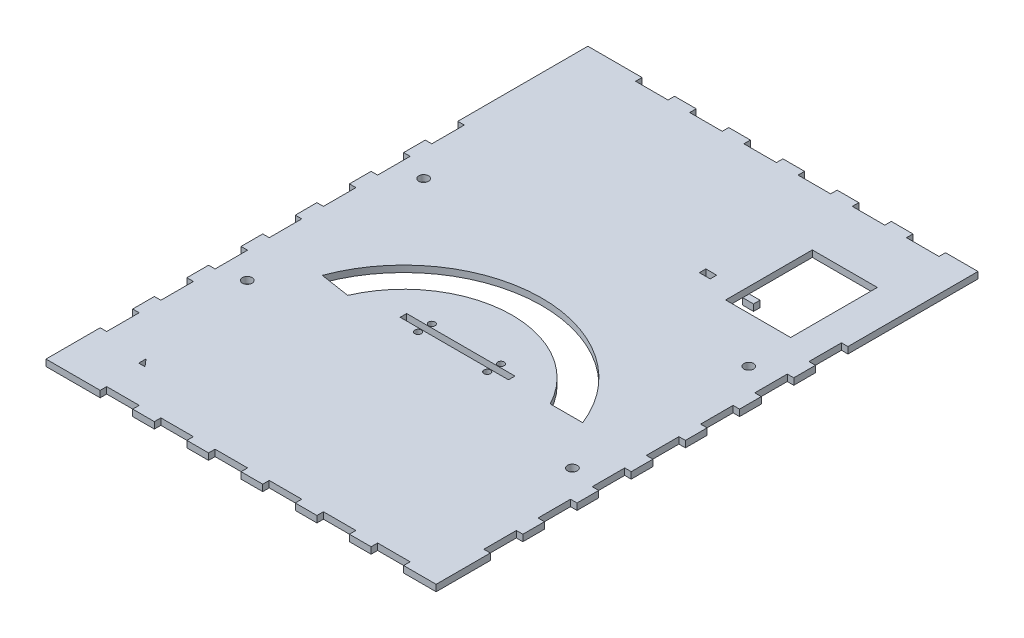
from build123d import *

# Parameters (mm, degrees)
BOSS_EXTRUDE1_DEPTH = 3
CUT_EXTRUDE1_DEPTH  = 10
SKETCH3_R           = 1.5
SKETCH3_R_2         = 2.25
SKETCH3_W           = 50
SKETCH3_H           = 3
SKETCH3_W_2         = 5
SKETCH3_W_3         = 30
SKETCH3_H_2         = 40
CUT_EXTRUDE8_DEPTH  = 9


with BuildPart() as part:
    # Sketch1 → Boss-Extrude1 (new body)
    with BuildSketch(Plane(origin=(0, 0, 0), x_dir=(1, 0, 0), z_dir=(0, 1, 0))):
        Polygon((-87.356947197, -190.101323735), (-90.356947197, -190.101323735), (-90.356947197, -215.101323735), (-65.356947197, -215.101323735), (-65.356947197, -212.101323735), (-50.356947197, -212.101323735), (-50.356947197, -215.101323735), (-40.356947197, -215.101323735), (-40.356947197, -212.101323735), (-25.356947197, -212.101323735), (-25.356947197, -215.101323735), (-15.356947197, -215.101323735), (-15.356947197, -212.101323735), (-0.356947197, -212.101323735), (-0.356947197, -215.101323735), (9.643052803, -215.101323735), (9.643052803, -212.101323735), (24.643052803, -212.101323735), (24.643052803, -215.101323735), (34.643052803, -215.101323735), (34.643052803, -212.101323735), (49.643052803, -212.101323735), (49.643052803, -215.101323735), (59.643052803, -215.101323735), (59.643052803, -212.101323735), (74.643052803, -212.101323735), (74.643052803, -215.101323735), (89.643052803, -215.101323735), (89.643052803, -190.101323735), (86.643052803, -190.101323735), (86.643052803, -175.101323735), (89.643052803, -175.101323735), (89.643052803, -165.101323735), (86.643052803, -165.101323735), (86.643052803, -150.101323735), (89.643052803, -150.101323735), (89.643052803, -140.101323735), (86.643052803, -140.101323735), (86.643052803, -125.101323735), (89.643052803, -125.101323735), (89.643052803, -115.101323735), (86.643052803, -115.101323735), (86.643052803, -100.101323735), (89.643052803, -100.101323735), (89.643052803, -90.101323735), (86.643052803, -90.101323735), (86.643052803, -75.101323735), (89.643052803, -75.101323735), (89.643052803, -65.101323735), (86.643052803, -65.101323735), (86.643052803, -50.101323735), (89.643052803, -50.101323735), (89.643052803, -40.101323735), (86.643052803, -40.101323735), (86.643052803, -25.101323735), (89.643052803, -25.101323735), (89.643052803, 34.898676265), (74.643052803, 34.898676265), (74.643052803, 31.898676265), (59.643052803, 31.898676265), (59.643052803, 34.898676265), (49.643052803, 34.898676265), (49.643052803, 31.898676265), (34.643052803, 31.898676265), (34.643052803, 34.898676265), (24.643052803, 34.898676265), (24.643052803, 31.898676265), (9.643052803, 31.898676265), (9.643052803, 34.898676265), (-0.356947197, 34.898676265), (-0.356947197, 31.898676265), (-15.356947197, 31.898676265), (-15.356947197, 34.898676265), (-25.356947197, 34.898676265), (-25.356947197, 31.898676265), (-40.356947197, 31.898676265), (-40.356947197, 34.898676265), (-50.356947197, 34.898676265), (-50.356947197, 31.898676265), (-65.356947197, 31.898676265), (-65.356947197, 34.898676265), (-90.356947197, 34.898676265), (-90.356947197, -25.101323735), (-87.356947197, -25.101323735), (-87.356947197, -40.101323735), (-90.356947197, -40.101323735), (-90.356947197, -50.101323735), (-87.356947197, -50.101323735), (-87.356947197, -65.101323735), (-90.356947197, -65.101323735), (-90.356947197, -75.101323735), (-87.356947197, -75.101323735), (-87.356947197, -90.101323735), (-90.356947197, -90.101323735), (-90.356947197, -100.101323735), (-87.356947197, -100.101323735), (-87.356947197, -115.101323735), (-90.356947197, -115.101323735), (-90.356947197, -125.101323735), (-87.356947197, -125.101323735), (-87.356947197, -140.101323735), (-90.356947197, -140.101323735), (-90.356947197, -150.101323735), (-87.356947197, -150.101323735), (-87.356947197, -165.101323735), (-90.356947197, -165.101323735), (-90.356947197, -175.101323735), (-87.356947197, -175.101323735), align=None)
    extrude(amount=BOSS_EXTRUDE1_DEPTH)

    # Sketch2 → Cut-Extrude1 (cut)
    with BuildSketch(Plane(origin=(0, 3, 0), x_dir=(1, 0, 0), z_dir=(0, 1, 0))):
        Polygon((-67.349233766, -195.324857703), (-64.450496054, -195.324857703), (-67.349233766, -191.980160343), align=None)
    extrude(amount=-CUT_EXTRUDE1_DEPTH, mode=Mode.SUBTRACT)

    # Sketch3 → Cut-Extrude8 (cut)
    # profile 1 of 12: a face of its own
    with BuildSketch(Plane(origin=(0, 3, 0), x_dir=(1, 0, 0), z_dir=(0, 1, 0))):
        with Locations((16.528325313, -118.41000982)):
            Circle(SKETCH3_R)
    # profile 2 of 12: a face of its own
    with BuildSketch(Plane(origin=(0, 3, 0), x_dir=(1, 0, 0), z_dir=(0, 1, 0))):
        with Locations((-15.390359434, -118.41000982)):
            Circle(SKETCH3_R)
    # profile 3 of 12: a face of its own
    with BuildSketch(Plane(origin=(0, 3, 0), x_dir=(1, 0, 0), z_dir=(0, 1, 0))):
        with Locations((-15.390359434, -112.052831899)):
            Circle(SKETCH3_R)
    # profile 4 of 12: a face of its own
    with BuildSketch(Plane(origin=(0, 3, 0), x_dir=(1, 0, 0), z_dir=(0, 1, 0))):
        with Locations((16.528325313, -112.052831899)):
            Circle(SKETCH3_R)
    # profile 5 of 12: a face of its own
    with BuildSketch(Plane(origin=(0, 3, 0), x_dir=(1, 0, 0), z_dir=(0, 1, 0))):
        with Locations((-75.356947197, -55.861662529)):
            Circle(SKETCH3_R_2)
    # profile 6 of 12: a face of its own
    with BuildSketch(Plane(origin=(0, 3, 0), x_dir=(1, 0, 0), z_dir=(0, 1, 0))):
        with Locations((-75.356947197, -137.238576729)):
            Circle(SKETCH3_R_2)
    # profile 7 of 12: a face of its own
    with BuildSketch(Plane(origin=(0, 3, 0), x_dir=(1, 0, 0), z_dir=(0, 1, 0))):
        with Locations((74.643052803, -137.238576729)):
            Circle(SKETCH3_R_2)
    # profile 8 of 12: a face of its own
    with BuildSketch(Plane(origin=(0, 3, 0), x_dir=(1, 0, 0), z_dir=(0, 1, 0))):
        with Locations((74.643052803, -55.861662529)):
            Circle(SKETCH3_R_2)
    # profile 9 of 12: a face of its own
    with BuildSketch(Plane(origin=(0, 3, 0), x_dir=(1, 0, 0), z_dir=(0, 1, 0))):
        with BuildLine():
            Line((58.895396069, -116.720156007), (43.895396069, -116.720156007))
            ThreePointArc((43.895396069, -116.720156007), (-2.206223575, -90.045974146), (-46.210588013, -120.054093416))
            Line((-46.210588013, -120.054093416), (-60.064157424, -117.911479541))
            ThreePointArc((-60.064157424, -117.911479541), (-0.99455125, -76.358255248), (58.895396069, -116.720156007))
        make_face()
    # profile 10 of 12: a face of its own
    with BuildSketch(Plane(origin=(0, 3, 0), x_dir=(1, 0, 0), z_dir=(0, 1, 0))):
        with Locations((-0.356947197, -115.212278662)):
            Rectangle(SKETCH3_W, SKETCH3_H)
    # profile 11 of 12: a face of its own
    with BuildSketch(Plane(origin=(0, 3, 0), x_dir=(1, 0, 0), z_dir=(0, 1, 0))):
        with Locations((28.344385371, -28.366011118)):
            Rectangle(SKETCH3_W_2, SKETCH3_H)
    # profile 12 of 12: a face of its own
    with BuildSketch(Plane(origin=(0, 3, 0), x_dir=(1, 0, 0), z_dir=(0, 1, 0))):
        with Locations((57.812970231, -14.714691465)):
            Rectangle(SKETCH3_W_3, SKETCH3_H_2)
        with Locations((48.344385371, -28.366011118)):
            Rectangle(SKETCH3_W_2, SKETCH3_H, mode=Mode.SUBTRACT)
    extrude(amount=-CUT_EXTRUDE8_DEPTH, mode=Mode.SUBTRACT)


with BuildPart() as cut_extrude8_piece_1:
    # of the separate pieces the step leaves, piece 1, a body of its own (cut_extrude8_pieces)
    add(part.part.solids().sort_by_distance((89.643052803, 0, 25.101323735))[0])


with BuildPart() as cut_extrude8_piece_2:
    # of the separate pieces the step leaves, piece 2, a body of its own (cut_extrude8_pieces)
    add(part.part.solids().sort_by_distance((45.844385371, 0, 26.866011118))[0])


solid = Compound([cut_extrude8_piece_1.part, cut_extrude8_piece_2.part])
